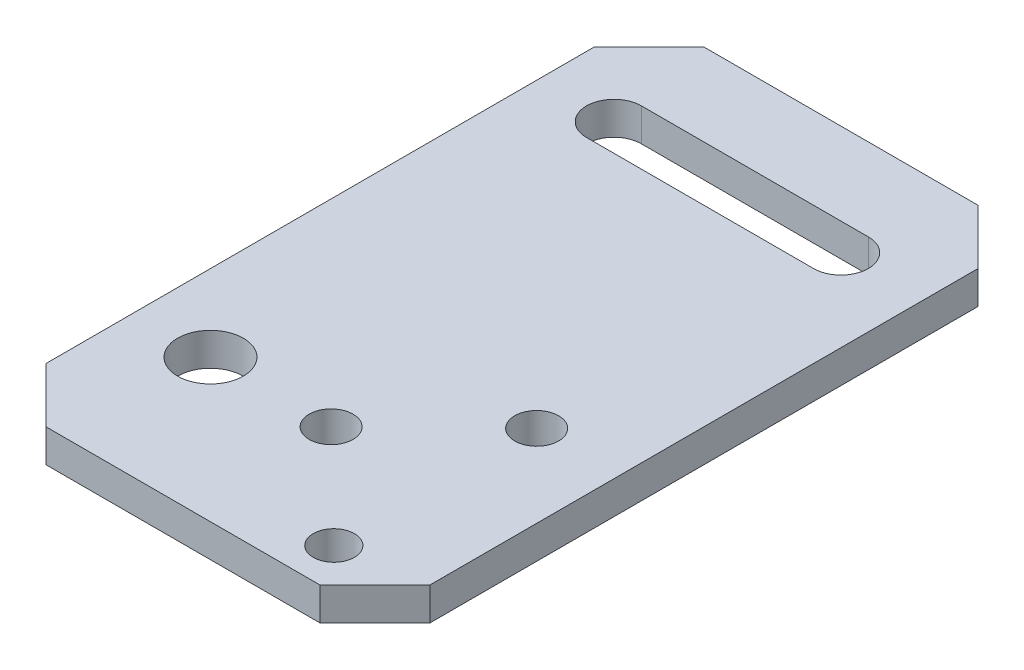
from build123d import *

# Parameters (mm, degrees)
CROQUIS1_W              = 35
CROQUIS1_H              = 60
CROQUIS1_R              = 3
CROQUIS1_R_2            = 2
CROQUIS1_R_3            = 1.878445215
SALIENTE_EXTRUIR1_DEPTH = 3
CHAFL_N1_SIZE           = 5


with BuildPart() as part:
    # Croquis1 → Saliente-Extruir1 (new body)
    with BuildSketch(Plane(origin=(0, 0, 0), x_dir=(1, 0, 0), z_dir=(0, 1, 0))):
        Rectangle(CROQUIS1_W, CROQUIS1_H)
        with Locations((-10.5, -17)):
            Circle(CROQUIS1_R, mode=Mode.SUBTRACT)
        with Locations((0.5, -17)):
            Circle(CROQUIS1_R_2, mode=Mode.SUBTRACT)
        with Locations((10, -7.75)):
            Circle(CROQUIS1_R_2, mode=Mode.SUBTRACT)
        with Locations((10, -26.25)):
            Circle(CROQUIS1_R_3, mode=Mode.SUBTRACT)
        with BuildLine():
            Line((-10.7, 17.5), (10, 17.5))
            ThreePointArc((10, 17.5), (12.5, 20), (10, 22.5))
            Line((10, 22.5), (-10.7, 22.5))
            ThreePointArc((-10.7, 22.5), (-13.2, 20), (-10.7, 17.5))
        make_face(mode=Mode.SUBTRACT)
    extrude(amount=SALIENTE_EXTRUIR1_DEPTH)

    # Chaflán1
    chafl_n1_edges = [part.edges().sort_by_distance(p)[0] for p in [
        (17.5, 1.5, 30),
        (-17.5, 1.5, 30),
        (17.5, 1.5, -30),
        (-17.5, 1.5, -30),
    ]]
    chamfer(chafl_n1_edges, length=CHAFL_N1_SIZE)


solid = part.part
